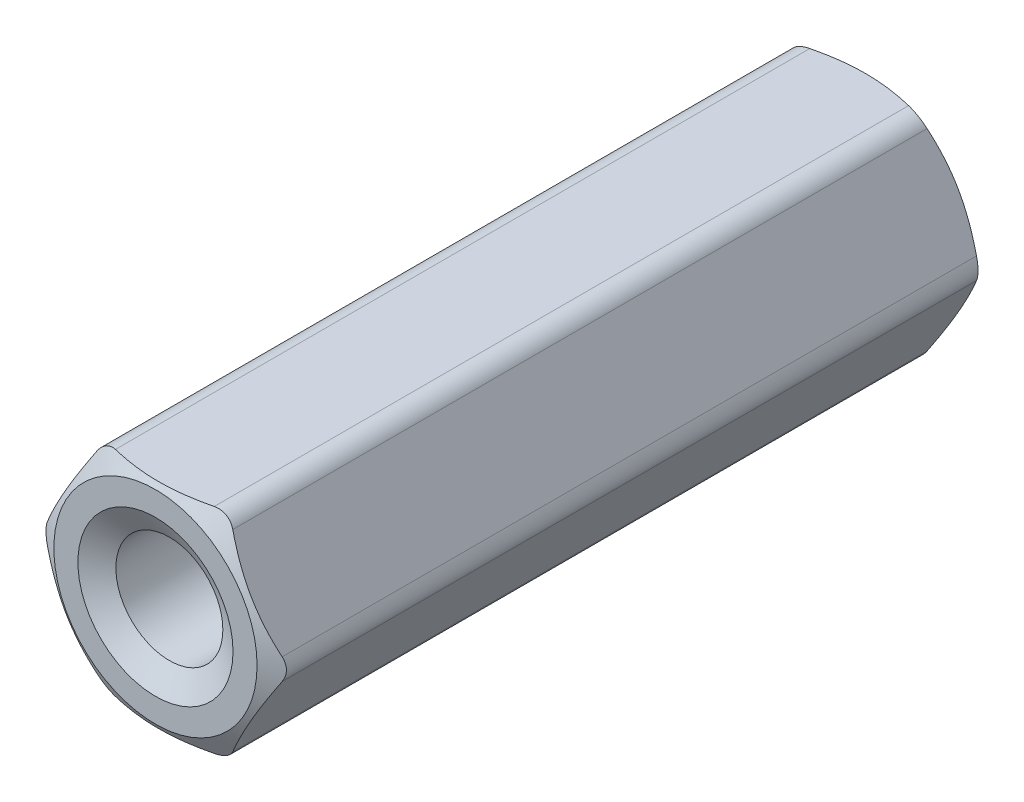
from build123d import *

# Parameters (mm, degrees)
SKETCH4_R           = 2.25
BOSS_EXTRUDE1_DEPTH = 10
SKETCH5_OUTSIDE_W   = 87.87
SKETCH5_OUTSIDE_H   = 86.942
SKETCH5_OUTSIDE_R   = 2.85
CUT_EXTRUDE1_DEPTH  = 21.518284529
CUT_EXTRUDE1_DRAFT  = -60
SKETCH6_OUTSIDE_W   = 87.87
SKETCH6_OUTSIDE_H   = 86.942
SKETCH6_OUTSIDE_R   = 2.85
CUT_EXTRUDE2_DEPTH  = 21.518284529
CUT_EXTRUDE2_DRAFT  = -60
FILLET1_R           = 0.6
BOSS_EXTRUDE2_START = -10
SKETCH7_R           = 2.175
BOSS_EXTRUDE2_DEPTH = 6.3
SKETCH8_W           = 6.3
SKETCH8_H           = 1.5
CIRPATTERN1_COUNT   = 2


with BuildPart() as part:
    # Sketch3 → Revolve1 (revolve)
    with BuildSketch(Plane(origin=(0, 0, 0), x_dir=(0, 0, -1), z_dir=(1, 0, 0))):
        Polygon((-9.610288568, 1.5), (-3.7, 1.5), (-3.7, 0), (3.7, 0), (3.7, 1.5), (9.610288568, 1.5), (10, 2.175), (10, 3), (0, 3), (-10, 3), (-10, 2.175), align=None)
        Polygon((-9.610288568, 1.5), (-3.7, 1.5), (-3.7, 0), (3.7, 0), (3.7, 1.5), (9.610288568, 1.5), (10, 2.175), (10, 3), (0, 3), (-10, 3), (-10, 2.175), align=None)
    revolve(axis=Axis((0, 0, 3.7), (0, 0, 1)))

    # Sketch4 → Boss-Extrude1 (add, symmetric)
    with BuildSketch(Plane.XY):
        Polygon((-1.732050808, 3), (-3.464101615, 0), (-1.732050808, -3), (1.732050808, -3), (3.464101615, 0), (1.732050808, 3), align=None)
        Circle(SKETCH4_R, mode=Mode.SUBTRACT)
    extrude(amount=BOSS_EXTRUDE1_DEPTH, both=True)


with BuildPart() as cut_extrude1_tool:
    # Sketch5 outside → Cut-Extrude1 (with draft: the straight prism first)
    with BuildSketch(Plane.XY.offset(10)):
        Rectangle(SKETCH5_OUTSIDE_W, SKETCH5_OUTSIDE_H)
        Circle(SKETCH5_OUTSIDE_R, mode=Mode.SUBTRACT)
    extrude(amount=-CUT_EXTRUDE1_DEPTH)
    # Cut-Extrude1: the draft: its side faces are tilted about the plane it starts from
    cut_extrude1_sides = [cut_extrude1_tool.faces().sort_by_distance(p)[0] for p in [
        (0, -43.471, -0.759142264),
        (43.935, 0, -0.759142264),
        (0, 43.471, -0.759142264),
        (-43.935, 0, -0.759142264),
        (-2.85, 0, -0.759142264),
    ]]
    draft(cut_extrude1_sides, Plane.XY.offset(10), CUT_EXTRUDE1_DRAFT)


with BuildPart() as part_1:
    add(part.part)

    # Cut-Extrude1: cut by cut_extrude1_tool
    add(cut_extrude1_tool.part, mode=Mode.SUBTRACT)


with BuildPart() as cut_extrude2_tool:
    # Sketch6 outside → Cut-Extrude2 (with draft: the straight prism first)
    with BuildSketch(Plane(origin=(0, 0, -10), x_dir=(-1, 0, 0), z_dir=(0, 0, -1))):
        Rectangle(SKETCH6_OUTSIDE_W, SKETCH6_OUTSIDE_H)
        Circle(SKETCH6_OUTSIDE_R, mode=Mode.SUBTRACT)
    extrude(amount=-CUT_EXTRUDE2_DEPTH)
    # Cut-Extrude2: the draft: its side faces are tilted about the plane it starts from
    cut_extrude2_sides = [cut_extrude2_tool.faces().sort_by_distance(p)[0] for p in [
        (0, -43.471, 0.759142264),
        (-43.935, 0, 0.759142264),
        (0, 43.471, 0.759142264),
        (43.935, 0, 0.759142264),
        (2.85, 0, 0.759142264),
    ]]
    draft(cut_extrude2_sides, Plane(origin=(0, 0, -10), x_dir=(-1, 0, 0), z_dir=(0, 0, -1)), CUT_EXTRUDE2_DRAFT)


with BuildPart() as part_2:
    add(part_1.part)

    # Cut-Extrude2: cut by cut_extrude2_tool
    add(cut_extrude2_tool.part, mode=Mode.SUBTRACT)

    # Fillet1
    # the kernel refuses this fillet: 0.6 mm, written as the material it takes off along each edge
    with BuildSketch(Plane(origin=(1.732050808, 3, 10.511473671), x_dir=(-1, 0, 0), z_dir=(0, 0, -1)), Plane(origin=(-1.732050808, 3, 10.511473671), x_dir=(-0.5000000000000006, -0.8660254037844383, 0), z_dir=(0, 0, -1))) as fillet1_piece_1:
        with BuildLine():
            CenterArc((FILLET1_R * 0.57735026919, -FILLET1_R), FILLET1_R, 90, 60)
            Line((-FILLET1_R * 0.288675134595, -FILLET1_R * 0.5), (0, 0))
            Line((0, 0), (FILLET1_R * 0.57735026919, 0))
        make_face()
    extrude(amount=21.022947342, mode=Mode.SUBTRACT)
    with BuildSketch(Plane(origin=(-3.464101615, 0, -10.511473671), x_dir=(0.5000000000000008, -0.8660254037844383, 0), z_dir=(0, 0, 1)), Plane(origin=(-1.732050808, -3, -10.511473671), x_dir=(1, 0, 0), z_dir=(0, 0, 1)), Plane(origin=(1.732050808, -3, -10.511473671), x_dir=(0.5000000000000001, 0.8660254037844386, 0), z_dir=(0, 0, 1)), Plane(origin=(3.464101615, 0, 10.511473671), x_dir=(-0.4999999999999995, -0.8660254037844388, 0), z_dir=(0, 0, -1))) as fillet1_piece_2:
        with BuildLine():
            CenterArc((FILLET1_R * 0.57735026919, FILLET1_R), FILLET1_R, 210, 60)
            Line((-FILLET1_R * 0.288675134595, FILLET1_R * 0.5), (0, 0))
            Line((0, 0), (FILLET1_R * 0.57735026919, 0))
        make_face()
    extrude(amount=21.022947342, mode=Mode.SUBTRACT)

    # Sketch7 → Boss-Extrude2 (add)
    with BuildSketch(Plane(origin=(0, 0, 0), x_dir=(-1, 0, 0), z_dir=(0, 0, -1)).offset(BOSS_EXTRUDE2_START)):
        Circle(SKETCH7_R)
    extrude(amount=BOSS_EXTRUDE2_DEPTH)

    # SurfaceCut1
    split(bisect_by=Plane.XY, keep=Keep.TOP)


with BuildPart() as body_2:
    # Sketch8 → Revolve2 (revolve)
    with BuildSketch(Plane(origin=(0, 0, 0), x_dir=(0, 0, -1), z_dir=(1, 0, 0))):
        with Locations((-6.85, 0.75)):
            Rectangle(SKETCH8_W, SKETCH8_H)
    revolve(axis=Axis((0, 0, 3.7), (0, 0, 1)))


with BuildPart() as part_3:
    add(part_2.part)

    # Combine1: cut body 2
    add(body_2.part, mode=Mode.SUBTRACT)

    # Cut-Extrude3 cone 1 section (through the dimple's axis) → Cut-Extrude3 (revolve, cut)
    with BuildSketch(Plane(origin=(0, 0, 10), x_dir=(0, -1, 0), z_dir=(1, 0, 0))):
        Polygon((0, 0), (2.175, 0), (0, 1.255736835), align=None)
    revolve(axis=Axis((0, 0, 10), (0, 0, -1)), mode=Mode.SUBTRACT)


with BuildPart() as cirpattern1_1:
    # CirPattern1: pattern copy
    add(part_3.part.rotate(Axis((0, 0, 0), (1, 0, 0)), 1 * 360 / CIRPATTERN1_COUNT))


with BuildPart() as part_4:
    add(part_3.part)

    # Combine2: union CirPattern1_1
    add(cirpattern1_1.part)


solid = part_4.part
